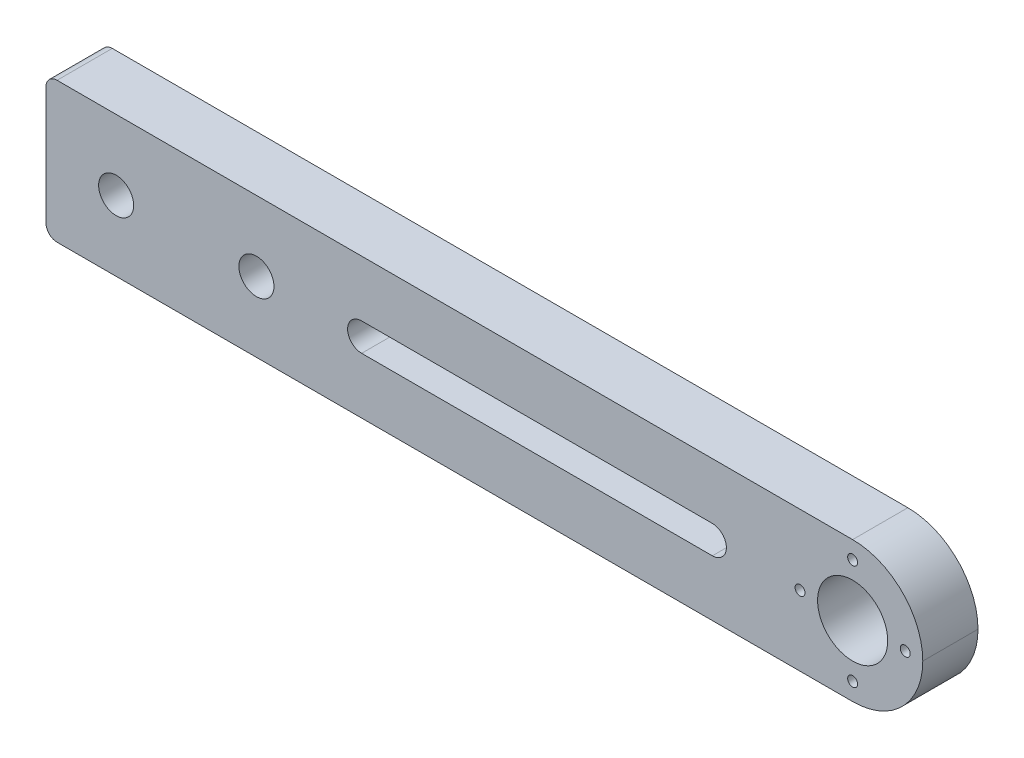
from build123d import *

# Parameters (mm, degrees)
SKETCH1_R           = 3.175
SKETCH1_R_2         = 6.35
SKETCH1_R_3         = 0.9
BOSS_EXTRUDE1_DEPTH = 10
FILLET2_R           = 2
FILLET3_R           = 12.7


with BuildPart() as part:
    # Sketch1 → Boss-Extrude1 (new body)
    with BuildSketch(Plane.XY):
        Polygon((-73.025, -12.7), (-73.025, 12.7), (73.025, 12.7), (85.725, 12.7), (85.725, -12.7), (73.025, -12.7), align=None)
        with Locations((-60.325, 0)):
            Circle(SKETCH1_R, mode=Mode.SUBTRACT)
        with Locations((73.025, 0)):
            Circle(SKETCH1_R_2, mode=Mode.SUBTRACT)
        with Locations((73.025, 9.525)):
            Circle(SKETCH1_R_3, mode=Mode.SUBTRACT)
        with Locations((73.025, -9.525)):
            Circle(SKETCH1_R_3, mode=Mode.SUBTRACT)
        with Locations((63.5, 0)):
            Circle(SKETCH1_R_3, mode=Mode.SUBTRACT)
        with Locations((82.55, 0)):
            Circle(SKETCH1_R_3, mode=Mode.SUBTRACT)
        with Locations((-34.925, 0)):
            Circle(SKETCH1_R, mode=Mode.SUBTRACT)
        with BuildLine():
            Line((-15.875, 2.54), (47.625, 2.54))
            ThreePointArc((47.625, 2.54), (50.165, 0), (47.625, -2.54))
            Line((47.625, -2.54), (-15.875, -2.54))
            ThreePointArc((-15.875, -2.54), (-18.415, 0), (-15.875, 2.54))
        make_face(mode=Mode.SUBTRACT)
    extrude(amount=BOSS_EXTRUDE1_DEPTH)

    # Fillet2
    fillet2_edges = [part.edges().sort_by_distance(p)[0] for p in [
        (-73.025, -12.7, 5),
        (-73.025, 12.7, 5),
    ]]
    fillet(fillet2_edges, radius=FILLET2_R)

    # Fillet3
    fillet3_edges = [part.edges().sort_by_distance(p)[0] for p in [
        (85.725, 12.7, 5),
        (85.725, -12.7, 5),
    ]]
    fillet(fillet3_edges, radius=FILLET3_R - 0.0001)  # a hair under: the kernel refuses the full size


solid = part.part
